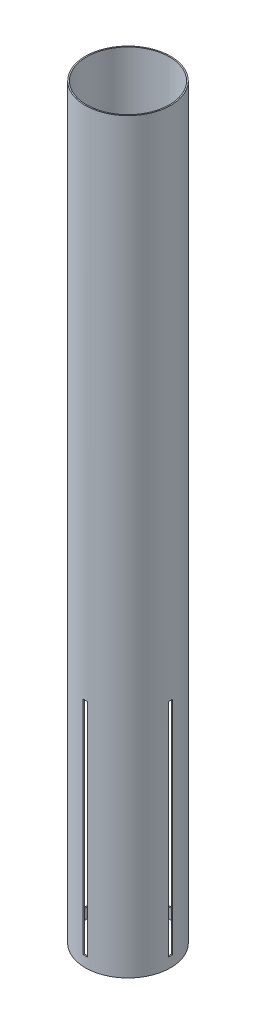
from build123d import *

# Parameters (mm, degrees)
SUSTAINER_TUBE_PROFILE_R   = 78.359
SUSTAINER_TUBE_PROFILE_R_2 = 76.2
SUSTAINER_TUBE_BODY_DEPTH  = 1371.6
FIN_SLOT_CUT_REACH         = 1384.746
FIN_SLOT_CUT_END_RADIUS    = 76.2
FIN_SLOT_PROFILE_W         = 7.9375
FIN_SLOT_PROFILE_H         = 406.4
FIN_SLOT_PATTERN_COUNT     = 4


with BuildPart() as part:
    # Sustainer Tube Profile → Sustainer Tube Body (new body)
    with BuildSketch(Plane(origin=(0, 0, 0), x_dir=(1, 0, 0), z_dir=(0, 1, 0))):
        Circle(SUSTAINER_TUBE_PROFILE_R)
        Circle(SUSTAINER_TUBE_PROFILE_R_2, mode=Mode.SUBTRACT)
    extrude(amount=SUSTAINER_TUBE_BODY_DEPTH)

    # Fin Slot Cut: up to this cylinder (the profile starts outside it)
    fin_slot_cut_end = Plane(origin=(0, 222.25, 0), z_dir=(0, -1, 0)) * Cylinder(FIN_SLOT_CUT_END_RADIUS, 2922.892, mode=Mode.PRIVATE)
    # Fin Slot Profile → Fin Slot Cut (cut, up to the surface)
    with BuildSketch(Plane.XY.offset(78.359), mode=Mode.PRIVATE) as fin_slot_cut_sk1:
        with Locations((0, 222.25)):
            Rectangle(FIN_SLOT_PROFILE_W, FIN_SLOT_PROFILE_H)
    fin_slot_cut_tool1 = extrude(fin_slot_cut_sk1.sketch, amount=-FIN_SLOT_CUT_REACH, mode=Mode.PRIVATE) - fin_slot_cut_end
    fin_slot_cut = fin_slot_cut_tool1.solids().sort_by_distance((0, 222.25, 78.359))[0]
    add(fin_slot_cut, mode=Mode.SUBTRACT)

    # Fin Slot Pattern: Fin Slot Cut ×4 about axis
    fin_slot_pattern_axis = Axis((0, 1371.6, 0), (0, 1, 0))
    for i in range(1, FIN_SLOT_PATTERN_COUNT):
        add(fin_slot_cut.rotate(fin_slot_pattern_axis, i * 360 / FIN_SLOT_PATTERN_COUNT), mode=Mode.SUBTRACT)


solid = part.part
